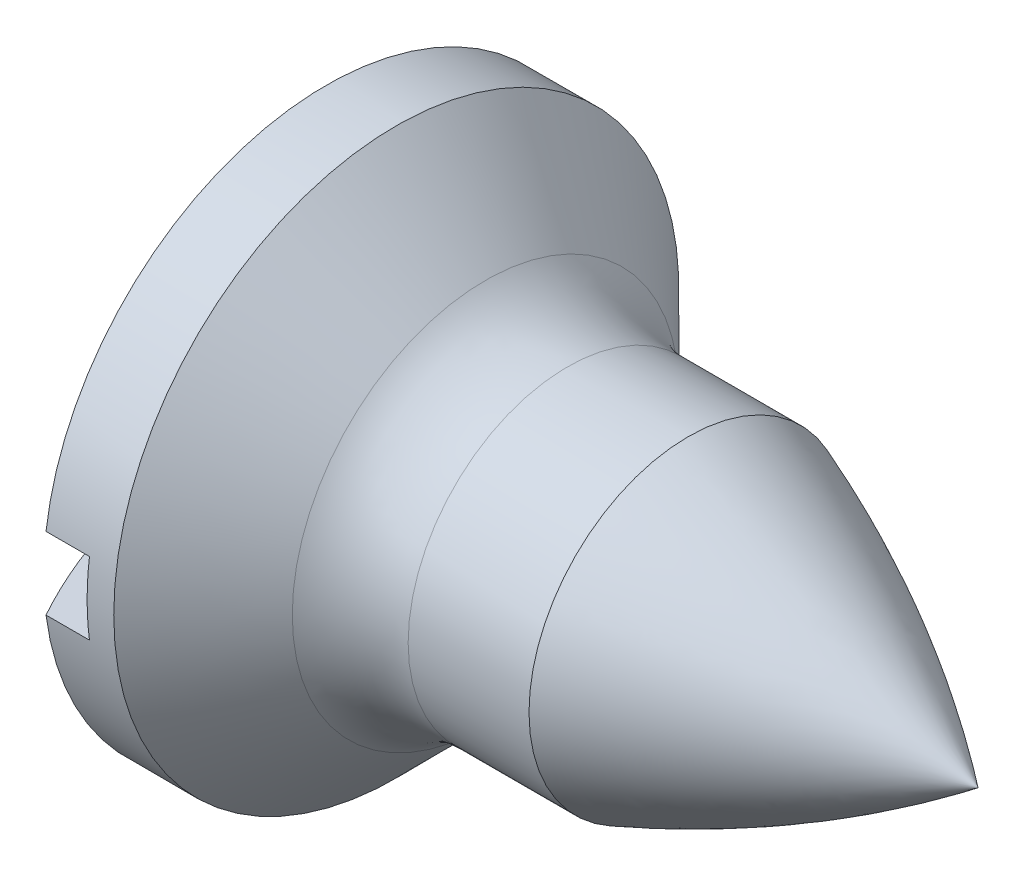
from build123d import *

# Parameters (mm, degrees)
SLOT_DEPTH      = 6.717309009
SLOT_DEPTH_BACK = 6.717309009


with BuildPart() as part:
    # Sketch1 → Base (revolve)
    with BuildSketch(Plane.XY):
        with BuildLine():
            Line((5.007820144, 1.1), (5.007820144, 0))
            Line((5.007820144, 0), (0, 0))
            ThreePointArc((0, 0), (0.129036333, 1.007789804), (0.507820144, 1.950558857))
            Line((0.507820144, 1.950558857), (0.991575862, 1.950558857))
            Line((0.991575862, 1.950558857), (1.607820144, 1.334314575))
            ThreePointArc((1.607820144, 1.334314575), (1.867358823, 1.160896374), (2.173505569, 1.1))
            Line((2.173505569, 1.1), (5.007820144, 1.1))
        make_face()
    revolve(axis=Axis((-40.194470106, 0, 0), (1, 0, 0)))

    # Sketch2 → Slot (cut, two sides: drawn at the far end of the back side and taken through both)
    with BuildSketch(Plane.XY.offset(-SLOT_DEPTH_BACK)):
        with BuildLine():
            Line((0.007820144, 0.25), (0.807820144, 0.25))
            Line((0.807820144, 0.25), (0.807820144, -0.25))
            Line((0.807820144, -0.25), (0.007820144, -0.25))
            ThreePointArc((0.007820144, -0.25), (-0.05119685, 0), (0.007820144, 0.25))
        make_face()
    extrude(amount=SLOT_DEPTH + SLOT_DEPTH_BACK, mode=Mode.SUBTRACT)

    # Sketch4 → Cut-Revolve6 (revolve, cut)
    with BuildSketch(Plane.XY):
        with BuildLine():
            Line((5.007820144, 0), (5.507820144, 0))
            Line((5.507820144, 0), (5.507820144, -1.1))
            Line((5.507820144, -1.1), (5.007820144, -1.1))
            Line((5.007820144, -1.1), (3.007820144, -1.1))
            ThreePointArc((3.007820144, -1.1), (4.047253004, -0.621696108), (5.007820144, 0))
        make_face()
    revolve(axis=Axis((35.861031454, 0, 0), (-1, 0, 0)), mode=Mode.SUBTRACT)


solid = part.part
